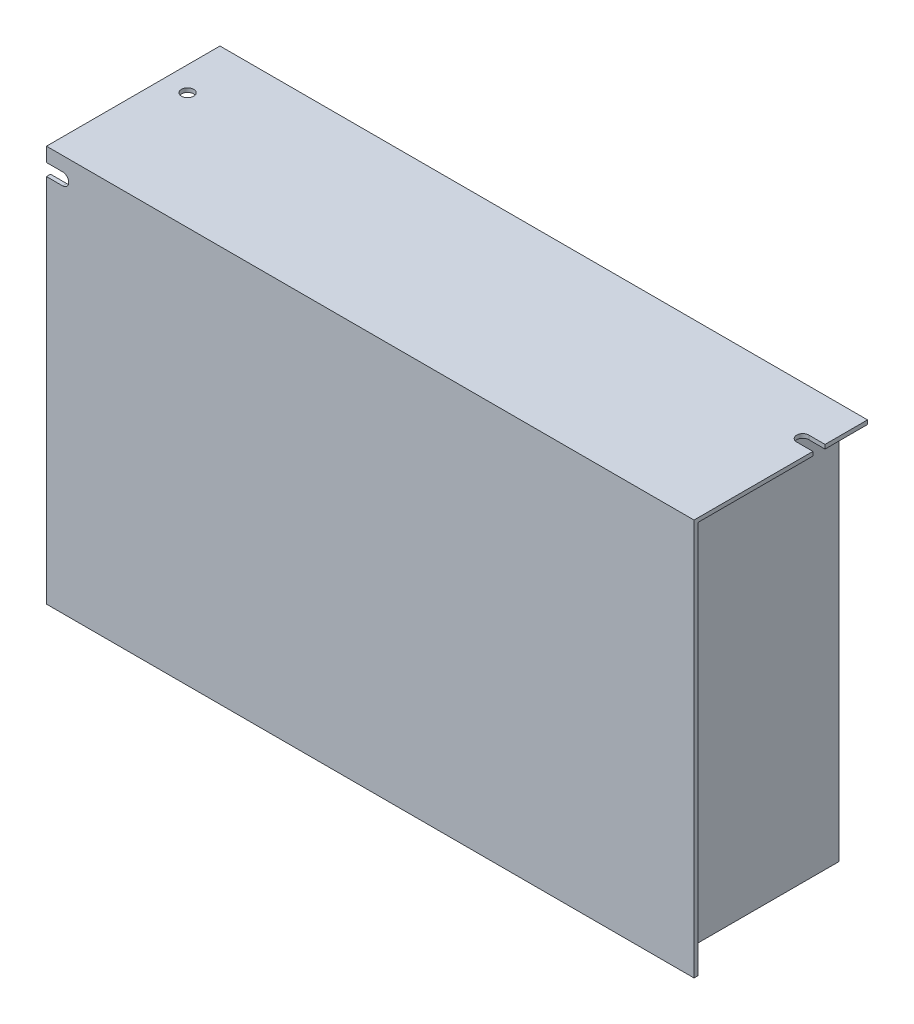
from build123d import *

# Parameters (mm, degrees)
SKETCH_1_W          = 140
SKETCH_1_H          = 42.868217054
EXTRUDE_1_DEPTH     = 98
EXTRUDE_2_DEPTH     = 13
EXTRUDE_3_DEPTH     = 7
CUT_EXTRUDE_1_DEPTH = 7
SKETCH_6_R          = 1.5
CUT_EXTRUDE_2_DEPTH = 7
CUT_EXTRUDE_3_DEPTH = 7
SHELL_START         = -97
SHELL_2_OUTLINE_W   = 139
SHELL_2_OUTLINE_H   = 40.868217054
SHELL_2_DEPTH       = 96
SKETCH_8_W          = 13
SKETCH_8_H          = 70
EXTRUDE_4_DEPTH     = 20
SKETCH_9_W          = 12
SKETCH_9_H          = 97
EXTRUDE_5_DEPTH     = 1
SKETCH_10_R         = 2
CUT_EXTRUDE_4_DEPTH = 1


# Read off the part's stored shape, not the designer's step: 抽壳2
with BuildPart() as part:
    # 草图1 → 凸台-拉伸1 (new body)
    with BuildSketch(Plane(origin=(0, 0, 0), x_dir=(1, 0, 0), z_dir=(0, 1, 0))):
        with Locations((70, 21.434108527)):
            Rectangle(SKETCH_1_W, SKETCH_1_H)
    extrude(amount=-EXTRUDE_1_DEPTH)

    # 草图3 → 凸台-拉伸2 (add)
    with BuildSketch(Plane.ZY):
        Polygon((0, -98), (-1, -98), (-1, -1), (-42.868217054, -1), (-42.868217054, 0), (0, 0), align=None)
    extrude(amount=EXTRUDE_2_DEPTH)

    # 草图4 → 凸台-拉伸3 (add)
    with BuildSketch(Plane(origin=(140, 0, 0), x_dir=(0, 0, -1), z_dir=(1, 0, 0))):
        Polygon((42.868217054, 0), (42.868217054, -1), (1, -1), (1, -98), (0, -98), (0, 0), align=None)
    extrude(amount=EXTRUDE_3_DEPTH)

    # 草图5 → 切除-拉伸1 (cut)
    with BuildSketch(Plane(origin=(0, 0, -1), x_dir=(-1, 0, 0), z_dir=(0, 0, -1))):
        with BuildLine():
            Line((21, -6.5), (9, -6.5))
            ThreePointArc((9, -6.5), (7.5, -5), (9, -3.5))
            Line((9, -3.5), (21, -3.5))
            ThreePointArc((21, -3.5), (22.5, -5), (21, -6.5))
        make_face()
    extrude(amount=-CUT_EXTRUDE_1_DEPTH, mode=Mode.SUBTRACT)

    # 草图6 → 切除-拉伸2 (cut)
    with BuildSketch(Plane.XZ.offset(1)):
        with Locations(Location((-7, -28.868217054, 0), (0, 0, 270))):
            Circle(SKETCH_6_R)
    extrude(amount=-CUT_EXTRUDE_2_DEPTH, mode=Mode.SUBTRACT)

    # 草图7 → 切除-拉伸3 (cut)
    with BuildSketch(Plane.XZ.offset(1)):
        with BuildLine():
            Line((143, -29.368217054), (151, -29.368217054))
            ThreePointArc((151, -29.368217054), (152.5, -30.868217054), (151, -32.368217054))
            Line((151, -32.368217054), (143, -32.368217054))
            ThreePointArc((143, -32.368217054), (141.5, -30.868217054), (143, -29.368217054))
        make_face()
    extrude(amount=-CUT_EXTRUDE_3_DEPTH, mode=Mode.SUBTRACT)

    # 抽壳2 outline → 抽壳2 (cut)
    with BuildSketch(Plane(origin=(0, 0, 0), x_dir=(1, 0, 0), z_dir=(0, 1, 0)).offset(SHELL_START)):
        with Locations((69.5, 21.434108527)):
            Rectangle(SHELL_2_OUTLINE_W, SHELL_2_OUTLINE_H)
    extrude(amount=SHELL_2_DEPTH, mode=Mode.SUBTRACT)

    # 草图8 → 凸台-拉伸4 (add)
    with BuildSketch(Plane(origin=(0, 0, -1), x_dir=(-1, 0, 0), z_dir=(0, 0, -1))):
        with Locations((6.5, -53)):
            Rectangle(SKETCH_8_W, SKETCH_8_H)
    extrude(amount=EXTRUDE_4_DEPTH)

    # 草图9 → 凸台-拉伸5 (add)
    with BuildSketch(Plane.ZY):
        with Locations((-36.868217054, -49.5)):
            Rectangle(SKETCH_9_W, SKETCH_9_H)
    extrude(amount=-EXTRUDE_5_DEPTH)

    # 草图10 → 切除-拉伸4 (cut)
    with BuildSketch(Plane(origin=(0, 0, -42.868217054), x_dir=(-1, 0, 0), z_dir=(0, 0, -1))):
        with Locations((-135.508864646, -6.633971192)):
            Circle(SKETCH_10_R)
        with Locations((-129.508864646, -12.633971192)):
            Circle(SKETCH_10_R)
        with Locations((-119.508864646, -12.633971192)):
            Circle(SKETCH_10_R)
        with Locations((-125.508864646, -6.633971192)):
            Circle(SKETCH_10_R)
        with Locations((-109.508864646, -12.633971192)):
            Circle(SKETCH_10_R)
        with Locations((-115.508864646, -6.633971192)):
            Circle(SKETCH_10_R)
        with Locations((-99.508864646, -12.633971192)):
            Circle(SKETCH_10_R)
        with Locations((-105.508864646, -6.633971192)):
            Circle(SKETCH_10_R)
        with Locations((-89.508864646, -12.633971192)):
            Circle(SKETCH_10_R)
        with Locations((-95.508864646, -6.633971192)):
            Circle(SKETCH_10_R)
        with Locations((-79.508864646, -12.633971192)):
            Circle(SKETCH_10_R)
        with Locations((-85.508864646, -6.633971192)):
            Circle(SKETCH_10_R)
        with Locations((-69.508864646, -12.633971192)):
            Circle(SKETCH_10_R)
        with Locations((-75.508864646, -6.633971192)):
            Circle(SKETCH_10_R)
        with Locations((-59.508864646, -12.633971192)):
            Circle(SKETCH_10_R)
        with Locations((-65.508864646, -6.633971192)):
            Circle(SKETCH_10_R)
        with Locations((-49.508864646, -12.633971192)):
            Circle(SKETCH_10_R)
        with Locations((-55.508864646, -6.633971192)):
            Circle(SKETCH_10_R)
        with Locations((-39.508864646, -12.633971192)):
            Circle(SKETCH_10_R)
        with Locations((-45.508864646, -6.633971192)):
            Circle(SKETCH_10_R)
        with Locations((-29.508864646, -12.633971192)):
            Circle(SKETCH_10_R)
        with Locations((-35.508864646, -6.633971192)):
            Circle(SKETCH_10_R)
        with Locations((-19.508864646, -12.633971192)):
            Circle(SKETCH_10_R)
        with Locations((-25.508864646, -6.633971192)):
            Circle(SKETCH_10_R)
        with Locations((-9.508864646, -12.633971192)):
            Circle(SKETCH_10_R)
        with Locations((-15.508864646, -6.633971192)):
            Circle(SKETCH_10_R)
        with Locations((-119.508864646, -22.633971192)):
            Circle(SKETCH_10_R)
        with Locations((-125.508864646, -16.633971192)):
            Circle(SKETCH_10_R)
        with Locations((-109.508864646, -22.633971192)):
            Circle(SKETCH_10_R)
        with Locations((-115.508864646, -16.633971192)):
            Circle(SKETCH_10_R)
        with Locations((-99.508864646, -22.633971192)):
            Circle(SKETCH_10_R)
        with Locations((-105.508864646, -16.633971192)):
            Circle(SKETCH_10_R)
        with Locations((-89.508864646, -22.633971192)):
            Circle(SKETCH_10_R)
        with Locations((-95.508864646, -16.633971192)):
            Circle(SKETCH_10_R)
        with Locations((-79.508864646, -22.633971192)):
            Circle(SKETCH_10_R)
        with Locations((-85.508864646, -16.633971192)):
            Circle(SKETCH_10_R)
        with Locations((-69.508864646, -22.633971192)):
            Circle(SKETCH_10_R)
        with Locations((-75.508864646, -16.633971192)):
            Circle(SKETCH_10_R)
        with Locations((-59.508864646, -22.633971192)):
            Circle(SKETCH_10_R)
        with Locations((-65.508864646, -16.633971192)):
            Circle(SKETCH_10_R)
        with Locations((-49.508864646, -22.633971192)):
            Circle(SKETCH_10_R)
        with Locations((-55.508864646, -16.633971192)):
            Circle(SKETCH_10_R)
        with Locations((-39.508864646, -22.633971192)):
            Circle(SKETCH_10_R)
        with Locations((-45.508864646, -16.633971192)):
            Circle(SKETCH_10_R)
        with Locations((-29.508864646, -22.633971192)):
            Circle(SKETCH_10_R)
        with Locations((-35.508864646, -16.633971192)):
            Circle(SKETCH_10_R)
        with Locations((-19.508864646, -22.633971192)):
            Circle(SKETCH_10_R)
        with Locations((-25.508864646, -16.633971192)):
            Circle(SKETCH_10_R)
        with Locations((-9.508864646, -22.633971192)):
            Circle(SKETCH_10_R)
        with Locations((-15.508864646, -16.633971192)):
            Circle(SKETCH_10_R)
        with Locations((-119.508864646, -32.633971192)):
            Circle(SKETCH_10_R)
        with Locations((-125.508864646, -26.633971192)):
            Circle(SKETCH_10_R)
        with Locations((-109.508864646, -32.633971192)):
            Circle(SKETCH_10_R)
        with Locations((-115.508864646, -26.633971192)):
            Circle(SKETCH_10_R)
        with Locations((-99.508864646, -32.633971192)):
            Circle(SKETCH_10_R)
        with Locations((-105.508864646, -26.633971192)):
            Circle(SKETCH_10_R)
        with Locations((-89.508864646, -32.633971192)):
            Circle(SKETCH_10_R)
        with Locations((-95.508864646, -26.633971192)):
            Circle(SKETCH_10_R)
        with Locations((-79.508864646, -32.633971192)):
            Circle(SKETCH_10_R)
        with Locations((-85.508864646, -26.633971192)):
            Circle(SKETCH_10_R)
        with Locations((-69.508864646, -32.633971192)):
            Circle(SKETCH_10_R)
        with Locations((-75.508864646, -26.633971192)):
            Circle(SKETCH_10_R)
        with Locations((-59.508864646, -32.633971192)):
            Circle(SKETCH_10_R)
        with Locations((-65.508864646, -26.633971192)):
            Circle(SKETCH_10_R)
        with Locations((-49.508864646, -32.633971192)):
            Circle(SKETCH_10_R)
        with Locations((-55.508864646, -26.633971192)):
            Circle(SKETCH_10_R)
        with Locations((-39.508864646, -32.633971192)):
            Circle(SKETCH_10_R)
        with Locations((-45.508864646, -26.633971192)):
            Circle(SKETCH_10_R)
        with Locations((-29.508864646, -32.633971192)):
            Circle(SKETCH_10_R)
        with Locations((-35.508864646, -26.633971192)):
            Circle(SKETCH_10_R)
        with Locations((-19.508864646, -32.633971192)):
            Circle(SKETCH_10_R)
        with Locations((-25.508864646, -26.633971192)):
            Circle(SKETCH_10_R)
        with Locations((-9.508864646, -32.633971192)):
            Circle(SKETCH_10_R)
        with Locations((-15.508864646, -26.633971192)):
            Circle(SKETCH_10_R)
        with Locations((-119.508864646, -42.633971192)):
            Circle(SKETCH_10_R)
        with Locations((-125.508864646, -36.633971192)):
            Circle(SKETCH_10_R)
        with Locations((-109.508864646, -42.633971192)):
            Circle(SKETCH_10_R)
        with Locations((-115.508864646, -36.633971192)):
            Circle(SKETCH_10_R)
        with Locations((-99.508864646, -42.633971192)):
            Circle(SKETCH_10_R)
        with Locations((-105.508864646, -36.633971192)):
            Circle(SKETCH_10_R)
        with Locations((-89.508864646, -42.633971192)):
            Circle(SKETCH_10_R)
        with Locations((-95.508864646, -36.633971192)):
            Circle(SKETCH_10_R)
        with Locations((-79.508864646, -42.633971192)):
            Circle(SKETCH_10_R)
        with Locations((-85.508864646, -36.633971192)):
            Circle(SKETCH_10_R)
        with Locations((-69.508864646, -42.633971192)):
            Circle(SKETCH_10_R)
        with Locations((-75.508864646, -36.633971192)):
            Circle(SKETCH_10_R)
        with Locations((-59.508864646, -42.633971192)):
            Circle(SKETCH_10_R)
        with Locations((-65.508864646, -36.633971192)):
            Circle(SKETCH_10_R)
        with Locations((-49.508864646, -42.633971192)):
            Circle(SKETCH_10_R)
        with Locations((-55.508864646, -36.633971192)):
            Circle(SKETCH_10_R)
        with Locations((-39.508864646, -42.633971192)):
            Circle(SKETCH_10_R)
        with Locations((-45.508864646, -36.633971192)):
            Circle(SKETCH_10_R)
        with Locations((-29.508864646, -42.633971192)):
            Circle(SKETCH_10_R)
        with Locations((-35.508864646, -36.633971192)):
            Circle(SKETCH_10_R)
        with Locations((-19.508864646, -42.633971192)):
            Circle(SKETCH_10_R)
        with Locations((-25.508864646, -36.633971192)):
            Circle(SKETCH_10_R)
        with Locations((-9.508864646, -42.633971192)):
            Circle(SKETCH_10_R)
        with Locations((-15.508864646, -36.633971192)):
            Circle(SKETCH_10_R)
        with Locations((-119.508864646, -52.633971192)):
            Circle(SKETCH_10_R)
        with Locations((-125.508864646, -46.633971192)):
            Circle(SKETCH_10_R)
        with Locations((-109.508864646, -52.633971192)):
            Circle(SKETCH_10_R)
        with Locations((-115.508864646, -46.633971192)):
            Circle(SKETCH_10_R)
        with Locations((-99.508864646, -52.633971192)):
            Circle(SKETCH_10_R)
        with Locations((-105.508864646, -46.633971192)):
            Circle(SKETCH_10_R)
        with Locations((-89.508864646, -52.633971192)):
            Circle(SKETCH_10_R)
        with Locations((-95.508864646, -46.633971192)):
            Circle(SKETCH_10_R)
        with Locations((-79.508864646, -52.633971192)):
            Circle(SKETCH_10_R)
        with Locations((-85.508864646, -46.633971192)):
            Circle(SKETCH_10_R)
        with Locations((-69.508864646, -52.633971192)):
            Circle(SKETCH_10_R)
        with Locations((-75.508864646, -46.633971192)):
            Circle(SKETCH_10_R)
        with Locations((-59.508864646, -52.633971192)):
            Circle(SKETCH_10_R)
        with Locations((-65.508864646, -46.633971192)):
            Circle(SKETCH_10_R)
        with Locations((-49.508864646, -52.633971192)):
            Circle(SKETCH_10_R)
        with Locations((-55.508864646, -46.633971192)):
            Circle(SKETCH_10_R)
        with Locations((-39.508864646, -52.633971192)):
            Circle(SKETCH_10_R)
        with Locations((-45.508864646, -46.633971192)):
            Circle(SKETCH_10_R)
        with Locations((-29.508864646, -52.633971192)):
            Circle(SKETCH_10_R)
        with Locations((-35.508864646, -46.633971192)):
            Circle(SKETCH_10_R)
        with Locations((-19.508864646, -52.633971192)):
            Circle(SKETCH_10_R)
        with Locations((-25.508864646, -46.633971192)):
            Circle(SKETCH_10_R)
        with Locations((-9.508864646, -52.633971192)):
            Circle(SKETCH_10_R)
        with Locations((-15.508864646, -46.633971192)):
            Circle(SKETCH_10_R)
        with Locations((-119.508864646, -62.633971192)):
            Circle(SKETCH_10_R)
        with Locations((-125.508864646, -56.633971192)):
            Circle(SKETCH_10_R)
        with Locations((-109.508864646, -62.633971192)):
            Circle(SKETCH_10_R)
        with Locations((-115.508864646, -56.633971192)):
            Circle(SKETCH_10_R)
        with Locations((-99.508864646, -62.633971192)):
            Circle(SKETCH_10_R)
        with Locations((-105.508864646, -56.633971192)):
            Circle(SKETCH_10_R)
        with Locations((-89.508864646, -62.633971192)):
            Circle(SKETCH_10_R)
        with Locations((-95.508864646, -56.633971192)):
            Circle(SKETCH_10_R)
        with Locations((-79.508864646, -62.633971192)):
            Circle(SKETCH_10_R)
        with Locations((-85.508864646, -56.633971192)):
            Circle(SKETCH_10_R)
        with Locations((-69.508864646, -62.633971192)):
            Circle(SKETCH_10_R)
        with Locations((-75.508864646, -56.633971192)):
            Circle(SKETCH_10_R)
        with Locations((-59.508864646, -62.633971192)):
            Circle(SKETCH_10_R)
        with Locations((-65.508864646, -56.633971192)):
            Circle(SKETCH_10_R)
        with Locations((-49.508864646, -62.633971192)):
            Circle(SKETCH_10_R)
        with Locations((-55.508864646, -56.633971192)):
            Circle(SKETCH_10_R)
        with Locations((-39.508864646, -62.633971192)):
            Circle(SKETCH_10_R)
        with Locations((-45.508864646, -56.633971192)):
            Circle(SKETCH_10_R)
        with Locations((-29.508864646, -62.633971192)):
            Circle(SKETCH_10_R)
        with Locations((-35.508864646, -56.633971192)):
            Circle(SKETCH_10_R)
        with Locations((-19.508864646, -62.633971192)):
            Circle(SKETCH_10_R)
        with Locations((-25.508864646, -56.633971192)):
            Circle(SKETCH_10_R)
        with Locations((-9.508864646, -62.633971192)):
            Circle(SKETCH_10_R)
        with Locations((-15.508864646, -56.633971192)):
            Circle(SKETCH_10_R)
        with Locations((-119.508864646, -72.633971192)):
            Circle(SKETCH_10_R)
        with Locations((-125.508864646, -66.633971192)):
            Circle(SKETCH_10_R)
        with Locations((-109.508864646, -72.633971192)):
            Circle(SKETCH_10_R)
        with Locations((-115.508864646, -66.633971192)):
            Circle(SKETCH_10_R)
        with Locations((-99.508864646, -72.633971192)):
            Circle(SKETCH_10_R)
        with Locations((-105.508864646, -66.633971192)):
            Circle(SKETCH_10_R)
        with Locations((-89.508864646, -72.633971192)):
            Circle(SKETCH_10_R)
        with Locations((-95.508864646, -66.633971192)):
            Circle(SKETCH_10_R)
        with Locations((-79.508864646, -72.633971192)):
            Circle(SKETCH_10_R)
        with Locations((-85.508864646, -66.633971192)):
            Circle(SKETCH_10_R)
        with Locations((-69.508864646, -72.633971192)):
            Circle(SKETCH_10_R)
        with Locations((-75.508864646, -66.633971192)):
            Circle(SKETCH_10_R)
        with Locations((-59.508864646, -72.633971192)):
            Circle(SKETCH_10_R)
        with Locations((-65.508864646, -66.633971192)):
            Circle(SKETCH_10_R)
        with Locations((-49.508864646, -72.633971192)):
            Circle(SKETCH_10_R)
        with Locations((-55.508864646, -66.633971192)):
            Circle(SKETCH_10_R)
        with Locations((-39.508864646, -72.633971192)):
            Circle(SKETCH_10_R)
        with Locations((-45.508864646, -66.633971192)):
            Circle(SKETCH_10_R)
        with Locations((-29.508864646, -72.633971192)):
            Circle(SKETCH_10_R)
        with Locations((-35.508864646, -66.633971192)):
            Circle(SKETCH_10_R)
        with Locations((-19.508864646, -72.633971192)):
            Circle(SKETCH_10_R)
        with Locations((-25.508864646, -66.633971192)):
            Circle(SKETCH_10_R)
        with Locations((-9.508864646, -72.633971192)):
            Circle(SKETCH_10_R)
        with Locations((-15.508864646, -66.633971192)):
            Circle(SKETCH_10_R)
        with Locations((-119.508864646, -82.633971192)):
            Circle(SKETCH_10_R)
        with Locations((-125.508864646, -76.633971192)):
            Circle(SKETCH_10_R)
        with Locations((-109.508864646, -82.633971192)):
            Circle(SKETCH_10_R)
        with Locations((-115.508864646, -76.633971192)):
            Circle(SKETCH_10_R)
        with Locations((-99.508864646, -82.633971192)):
            Circle(SKETCH_10_R)
        with Locations((-105.508864646, -76.633971192)):
            Circle(SKETCH_10_R)
        with Locations((-89.508864646, -82.633971192)):
            Circle(SKETCH_10_R)
        with Locations((-95.508864646, -76.633971192)):
            Circle(SKETCH_10_R)
        with Locations((-79.508864646, -82.633971192)):
            Circle(SKETCH_10_R)
        with Locations((-85.508864646, -76.633971192)):
            Circle(SKETCH_10_R)
        with Locations((-69.508864646, -82.633971192)):
            Circle(SKETCH_10_R)
        with Locations((-75.508864646, -76.633971192)):
            Circle(SKETCH_10_R)
        with Locations((-59.508864646, -82.633971192)):
            Circle(SKETCH_10_R)
        with Locations((-65.508864646, -76.633971192)):
            Circle(SKETCH_10_R)
        with Locations((-49.508864646, -82.633971192)):
            Circle(SKETCH_10_R)
        with Locations((-55.508864646, -76.633971192)):
            Circle(SKETCH_10_R)
        with Locations((-39.508864646, -82.633971192)):
            Circle(SKETCH_10_R)
        with Locations((-45.508864646, -76.633971192)):
            Circle(SKETCH_10_R)
        with Locations((-29.508864646, -82.633971192)):
            Circle(SKETCH_10_R)
        with Locations((-35.508864646, -76.633971192)):
            Circle(SKETCH_10_R)
        with Locations((-19.508864646, -82.633971192)):
            Circle(SKETCH_10_R)
        with Locations((-25.508864646, -76.633971192)):
            Circle(SKETCH_10_R)
        with Locations((-9.508864646, -82.633971192)):
            Circle(SKETCH_10_R)
        with Locations((-15.508864646, -76.633971192)):
            Circle(SKETCH_10_R)
        with Locations((-119.508864646, -92.633971192)):
            Circle(SKETCH_10_R)
        with Locations((-125.508864646, -86.633971192)):
            Circle(SKETCH_10_R)
        with Locations((-109.508864646, -92.633971192)):
            Circle(SKETCH_10_R)
        with Locations((-115.508864646, -86.633971192)):
            Circle(SKETCH_10_R)
        with Locations((-99.508864646, -92.633971192)):
            Circle(SKETCH_10_R)
        with Locations((-105.508864646, -86.633971192)):
            Circle(SKETCH_10_R)
        with Locations((-89.508864646, -92.633971192)):
            Circle(SKETCH_10_R)
        with Locations((-95.508864646, -86.633971192)):
            Circle(SKETCH_10_R)
        with Locations((-79.508864646, -92.633971192)):
            Circle(SKETCH_10_R)
        with Locations((-85.508864646, -86.633971192)):
            Circle(SKETCH_10_R)
        with Locations((-69.508864646, -92.633971192)):
            Circle(SKETCH_10_R)
        with Locations((-75.508864646, -86.633971192)):
            Circle(SKETCH_10_R)
        with Locations((-59.508864646, -92.633971192)):
            Circle(SKETCH_10_R)
        with Locations((-65.508864646, -86.633971192)):
            Circle(SKETCH_10_R)
        with Locations((-49.508864646, -92.633971192)):
            Circle(SKETCH_10_R)
        with Locations((-55.508864646, -86.633971192)):
            Circle(SKETCH_10_R)
        with Locations((-39.508864646, -92.633971192)):
            Circle(SKETCH_10_R)
        with Locations((-45.508864646, -86.633971192)):
            Circle(SKETCH_10_R)
        with Locations((-29.508864646, -92.633971192)):
            Circle(SKETCH_10_R)
        with Locations((-35.508864646, -86.633971192)):
            Circle(SKETCH_10_R)
        with Locations((-19.508864646, -92.633971192)):
            Circle(SKETCH_10_R)
        with Locations((-25.508864646, -86.633971192)):
            Circle(SKETCH_10_R)
        with Locations((-9.508864646, -92.633971192)):
            Circle(SKETCH_10_R)
        with Locations((-15.508864646, -86.633971192)):
            Circle(SKETCH_10_R)
        with Locations((-129.508864646, -22.633971192)):
            Circle(SKETCH_10_R)
        with Locations((-135.508864646, -16.633971192)):
            Circle(SKETCH_10_R)
        with Locations((-129.508864646, -32.633971192)):
            Circle(SKETCH_10_R)
        with Locations((-135.508864646, -26.633971192)):
            Circle(SKETCH_10_R)
        with Locations((-129.508864646, -42.633971192)):
            Circle(SKETCH_10_R)
        with Locations((-135.508864646, -36.633971192)):
            Circle(SKETCH_10_R)
        with Locations((-129.508864646, -52.633971192)):
            Circle(SKETCH_10_R)
        with Locations((-135.508864646, -46.633971192)):
            Circle(SKETCH_10_R)
        with Locations((-129.508864646, -62.633971192)):
            Circle(SKETCH_10_R)
        with Locations((-135.508864646, -56.633971192)):
            Circle(SKETCH_10_R)
        with Locations((-129.508864646, -72.633971192)):
            Circle(SKETCH_10_R)
        with Locations((-135.508864646, -66.633971192)):
            Circle(SKETCH_10_R)
        with Locations((-129.508864646, -82.633971192)):
            Circle(SKETCH_10_R)
        with Locations((-135.508864646, -76.633971192)):
            Circle(SKETCH_10_R)
        with Locations((-129.508864646, -92.633971192)):
            Circle(SKETCH_10_R)
        with Locations((-135.508864646, -86.633971192)):
            Circle(SKETCH_10_R)
    extrude(amount=-CUT_EXTRUDE_4_DEPTH, mode=Mode.SUBTRACT)


solid = part.part
